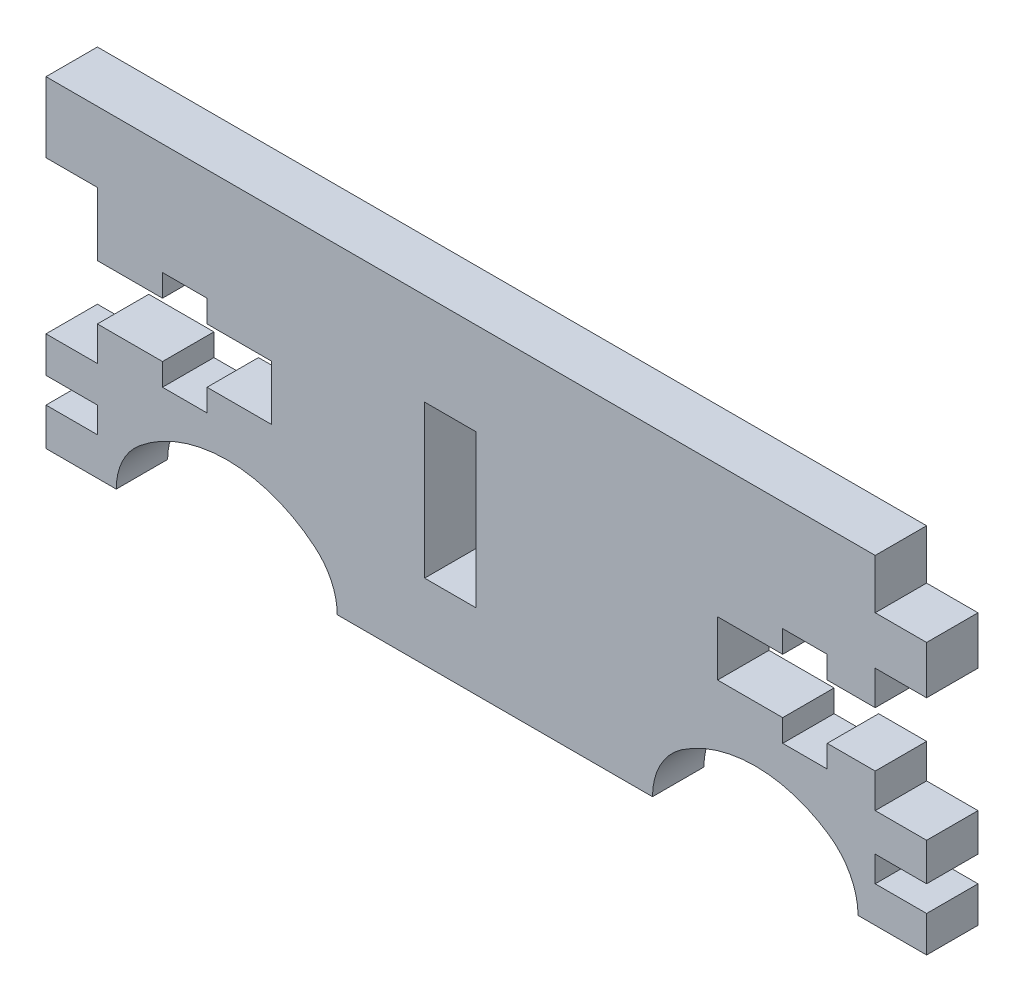
from build123d import *

# Parameters (mm, degrees)
ESQUISSE1_W               = 3
ESQUISSE1_H               = 8.9
T_LE_DE_BASE_PLI_E1_DEPTH = 3


# Sheet-metal steps are written as plain solids
with BuildPart() as part:
    # Esquisse1 → Tôle de base pliée1 (new body)
    with BuildSketch(Plane.XY):
        with BuildLine():
            Line((40.706473987, 1340.134366737), (89.106473987, 1340.134366737))
            Line((89.106473987, 1340.134366737), (89.106473987, 1337.234366737))
            Line((89.106473987, 1337.234366737), (92.106473987, 1337.234366737))
            Line((92.106473987, 1337.234366737), (92.106473987, 1334.434366737))
            Line((92.106473987, 1334.434366737), (89.106473987, 1334.434366737))
            Line((89.106473987, 1334.434366737), (89.106473987, 1332.434279902))
            Line((89.106473987, 1332.434279902), (86.306473987, 1332.434279902))
            Line((86.306473987, 1332.434279902), (86.306473987, 1333.734279902))
            Line((86.306473987, 1333.734279902), (83.706473987, 1333.734279902))
            Line((83.706473987, 1333.734279902), (83.706473987, 1332.434279902))
            Line((83.706473987, 1332.434279902), (79.906473987, 1332.434279902))
            Line((79.906473987, 1332.434279902), (79.906473987, 1329.234279902))
            Line((79.906473987, 1329.234279902), (83.706473987, 1329.234279902))
            Line((83.706473987, 1329.234279902), (83.706473987, 1327.934279902))
            Line((83.706473987, 1327.934279902), (86.306473987, 1327.934279902))
            Line((86.306473987, 1327.934279902), (86.306473987, 1329.234279902))
            Line((86.306473987, 1329.234279902), (89.106473987, 1329.234279902))
            Line((89.106473987, 1329.234279902), (89.106473987, 1327.234279902))
            Line((89.106473987, 1327.234279902), (92.106473987, 1327.234279902))
            Line((92.106473987, 1327.234279902), (92.106473987, 1325.034279902))
            Line((92.106473987, 1325.034279902), (89.106473987, 1325.034279902))
            Line((89.106473987, 1325.034279902), (89.106473987, 1323.534279902))
            Line((89.106473987, 1323.534279902), (92.106473987, 1323.534279902))
            Line((92.106473987, 1323.534279902), (92.106473987, 1321.434279902))
            Line((92.106473987, 1321.434279902), (88.10455642, 1321.434279902))
            ThreePointArc((88.10455642, 1321.434279902), (87.652661624, 1323.258995148), (86.401432588, 1324.661927983))
            ThreePointArc((86.401432588, 1324.661927983), (82.105492294, 1325.990171363), (77.809552, 1324.661927983))
            ThreePointArc((77.809552, 1324.661927983), (76.558356626, 1323.259032892), (76.106473987, 1321.434366737))
            Line((76.106473987, 1321.434366737), (57.706473987, 1321.434366737))
            ThreePointArc((57.706473987, 1321.434366737), (57.366344351, 1322.959443215), (56.410421102, 1324.195467962))
            ThreePointArc((56.410421102, 1324.195467962), (51.279943841, 1326.048095935), (46.149466581, 1324.195467962))
            ThreePointArc((46.149466581, 1324.195467962), (45.158922245, 1322.914677571), (44.806473987, 1321.334366737))
            Line((44.806473987, 1321.334366737), (40.706473987, 1321.334366737))
            Line((40.706473987, 1321.334366737), (40.706473987, 1323.534366737))
            Line((40.706473987, 1323.534366737), (43.706473987, 1323.534366737))
            Line((43.706473987, 1323.534366737), (43.706473987, 1325.034366737))
            Line((43.706473987, 1325.034366737), (40.706473987, 1325.034366737))
            Line((40.706473987, 1325.034366737), (40.706473987, 1327.134366737))
            Line((40.706473987, 1327.134366737), (43.706473987, 1327.134366737))
            Line((43.706473987, 1327.134366737), (43.706473987, 1329.134366737))
            Line((43.706473987, 1329.134366737), (47.506473987, 1329.134366737))
            Line((47.506473987, 1329.134366737), (47.506473987, 1327.834366737))
            Line((47.506473987, 1327.834366737), (50.106473987, 1327.834366737))
            Line((50.106473987, 1327.834366737), (50.106473987, 1329.134366737))
            Line((50.106473987, 1329.134366737), (53.856473987, 1329.134366737))
            Line((53.856473987, 1329.134366737), (53.856473987, 1332.334366737))
            Line((53.856473987, 1332.334366737), (50.106473987, 1332.334366737))
            Line((50.106473987, 1332.334366737), (50.106473987, 1333.634366737))
            Line((50.106473987, 1333.634366737), (47.506473987, 1333.634366737))
            Line((47.506473987, 1333.634366737), (47.506473987, 1332.334366737))
            Line((47.506473987, 1332.334366737), (43.706473987, 1332.334366737))
            Line((43.706473987, 1332.334366737), (43.706473987, 1336.034366737))
            Line((43.706473987, 1336.034366737), (40.706473987, 1336.034366737))
            Line((40.706473987, 1336.034366737), (40.706473987, 1340.134366737))
        make_face()
        with Locations((64.306473987, 1330.284366737)):
            Rectangle(ESQUISSE1_W, ESQUISSE1_H, mode=Mode.SUBTRACT)
    extrude(amount=-T_LE_DE_BASE_PLI_E1_DEPTH)


solid = part.part
